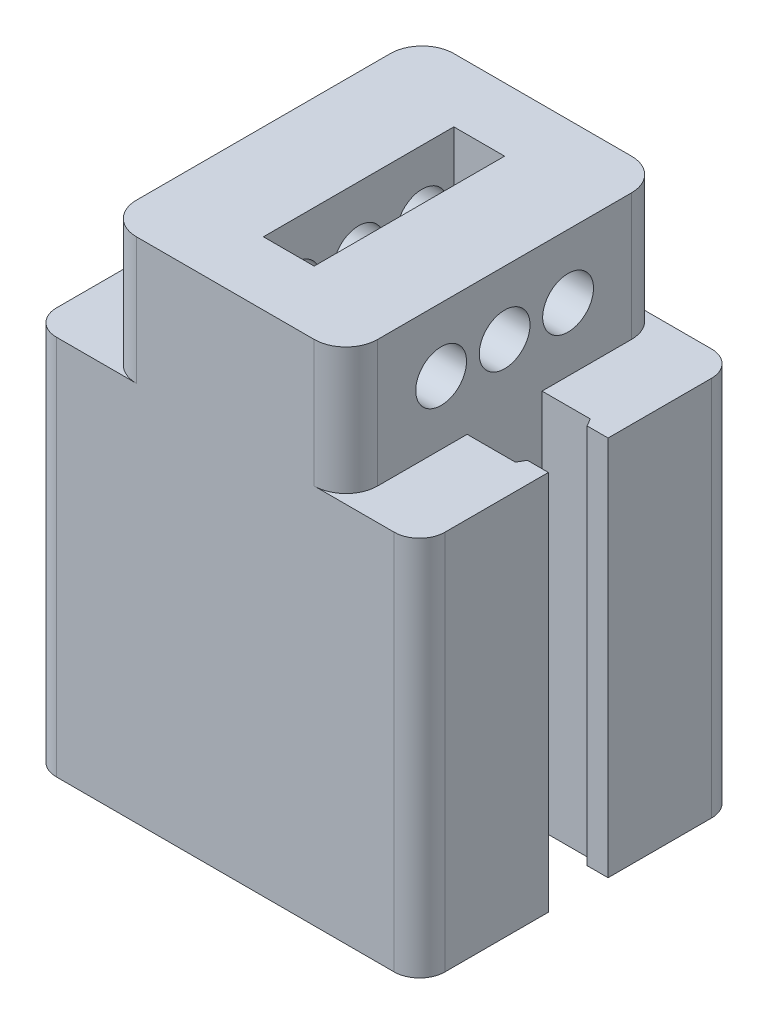
from build123d import *
from OCP.BRepAlgoAPI import BRepAlgoAPI_Cut
from OCP.TopTools import TopTools_ListOfShape

# Parameters (mm, degrees)
BOSS_EXTRUDE1_DEPTH = 30
SKETCH3_W           = 4
SKETCH3_H           = 15
BOSS_EXTRUDE2_DEPTH = 10
SKETCH4_W           = 4
SKETCH4_H           = 15
CUT_EXTRUDE1_DEPTH  = 35
SKETCH5_R           = 2
CUT_EXTRUDE2_DEPTH  = 35


with BuildPart() as part:
    # Sketch2 → Boss-Extrude1 (new body)
    with BuildSketch(Plane(origin=(0, 0, 0), x_dir=(1, 0, 0), z_dir=(0, 1, 0))):
        with BuildLine():
            ThreePointArc((-13.300000086, 12.500000186), (-14.714213649, 11.914213749), (-15.300000086, 10.500000186))
            Line((-15.300000086, 10.500000186), (-15.300000086, 2.350000088))
            Line((-15.300000086, 2.350000088), (-13.646409847, 2.350000088))
            Line((-13.646409847, 2.350000088), (-13.299999759, 2.95))
            Line((-13.299999759, 2.95), (-9.499999695, 2.95))
            Line((-9.499999695, 2.95), (-9.499999695, -2.95))
            Line((-9.499999695, -2.95), (-13.299999759, -2.95))
            Line((-13.299999759, -2.95), (-13.646409847, -2.350000088))
            Line((-13.646409847, -2.350000088), (-15.300000086, -2.350000088))
            Line((-15.300000086, -2.350000088), (-15.300000086, -10.500000186))
            ThreePointArc((-15.300000086, -10.500000186), (-14.714213649, -11.914213749), (-13.300000086, -12.500000186))
            Line((-13.300000086, -12.500000186), (13.300000086, -12.500000186))
            ThreePointArc((13.300000086, -12.500000186), (14.714213649, -11.914213749), (15.300000086, -10.500000186))
            Line((15.300000086, -10.500000186), (15.300000086, -2.350000088))
            Line((15.300000086, -2.350000088), (13.646408916, -2.350000088))
            Line((13.646408916, -2.350000088), (13.299999759, -2.95))
            Line((13.299999759, -2.95), (9.499998763, -2.95))
            Line((9.499998763, -2.95), (9.499998763, 2.95))
            Line((9.499998763, 2.95), (13.299999759, 2.95))
            Line((13.299999759, 2.95), (13.646408916, 2.350000088))
            Line((13.646408916, 2.350000088), (15.300000086, 2.350000088))
            Line((15.300000086, 2.350000088), (15.300000086, 10.500000186))
            ThreePointArc((15.300000086, 10.500000186), (14.714213649, 11.914213749), (13.300000086, 12.500000186))
            Line((13.300000086, 12.500000186), (-13.300000086, 12.500000186))
        make_face()
    extrude(amount=BOSS_EXTRUDE1_DEPTH)

    # Sketch3 → Boss-Extrude2 (add)
    with BuildSketch(Plane(origin=(0, 30, 0), x_dir=(1, 0, 0), z_dir=(0, 1, 0))):
        with BuildLine():
            ThreePointArc((-9.499999695, -10.000000186), (-8.767766647, -11.767767139), (-6.999999695, -12.500000186))
            Line((-6.999999695, -12.500000186), (6.999999695, -12.500000186))
            ThreePointArc((6.999999695, -12.500000186), (8.767766647, -11.767767139), (9.499999695, -10.000000186))
            Line((9.499999695, -10.000000186), (9.499999695, 10.000000186))
            ThreePointArc((9.499999695, 10.000000186), (8.767766647, 11.767767139), (6.999999695, 12.500000186))
            Line((6.999999695, 12.500000186), (-6.999999695, 12.500000186))
            ThreePointArc((-6.999999695, 12.500000186), (-8.767766647, 11.767767139), (-9.499999695, 10.000000186))
            Line((-9.499999695, 10.000000186), (-9.499999695, -10.000000186))
        make_face()
        Rectangle(SKETCH3_W, SKETCH3_H, mode=Mode.SUBTRACT)
    extrude(amount=BOSS_EXTRUDE2_DEPTH)

    # Sketch4 → Cut-Extrude1 (cut)
    with BuildSketch(Plane(origin=(0, 40, 0), x_dir=(1, 0, 0), z_dir=(0, 1, 0))):
        Rectangle(SKETCH4_W, SKETCH4_H)
    extrude(amount=-CUT_EXTRUDE1_DEPTH, mode=Mode.SUBTRACT)


with BuildPart() as cut_extrude2_tool:
    # Sketch5 → Cut-Extrude2 (new body)
    with BuildSketch(Plane(origin=(9.499998763, 0, 0), x_dir=(0, 0, -1), z_dir=(1, 0, 0))):
        with Locations((0, 35)):
            Circle(SKETCH5_R)
        with Locations((5, 35)):
            Circle(SKETCH5_R)
        with Locations((-5, 35)):
            Circle(SKETCH5_R)
    extrude(amount=-CUT_EXTRUDE2_DEPTH)


with BuildPart() as part_1:
    add(part.part)

    # Cut-Extrude2: cut by cut_extrude2_tool, with a tolerance
    cut_extrude2_stock = TopTools_ListOfShape()
    cut_extrude2_stock.Append(part_1.part.wrapped)
    cut_extrude2_tools = TopTools_ListOfShape()
    cut_extrude2_tools.Append(cut_extrude2_tool.part.wrapped)
    cut_extrude2_cut = BRepAlgoAPI_Cut()
    cut_extrude2_cut.SetArguments(cut_extrude2_stock)
    cut_extrude2_cut.SetTools(cut_extrude2_tools)
    cut_extrude2_cut.SetFuzzyValue(0.00001)
    cut_extrude2_cut.Build()
    add(Compound.cast(cut_extrude2_cut.Shape()).solids(), mode=Mode.REPLACE)


solid = part_1.part
